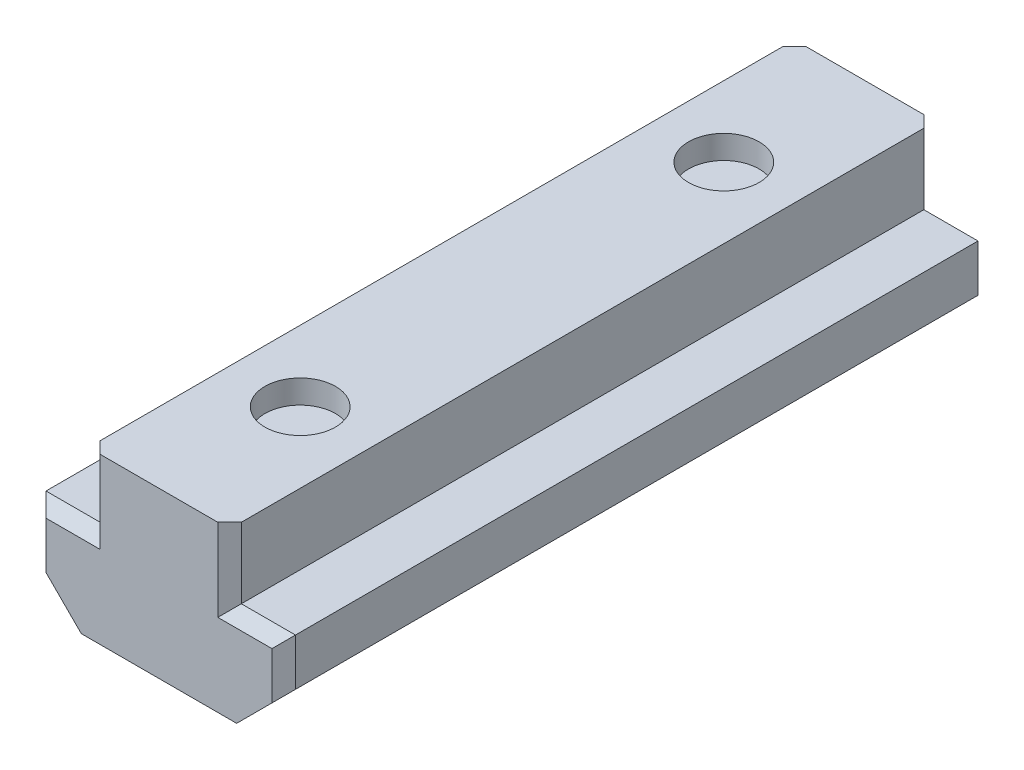
from build123d import *

# Parameters (mm, degrees)
EXTRUDE_1_DEPTH     = 15
CHAMFER_1_SIZE      = 2
CHAMFER_2_SIZE      = 0.5
MIRROR_START        = -9.237604307
MIRROR_2_DEPTH      = 2.598076211
MIRROR_START_2      = 6.639528096
MIRROR_2_2_DEPTH    = 2.598076211
SKETCH_2_R          = 1.5
CUT_EXTRUDE_1_DEPTH = 1


# Read off the part's stored shape, not the designer's step: 镜向2
with BuildPart() as part:
    # 草图1 → 凸台-拉伸1 (new, symmetric)
    with BuildSketch(Plane.XY):
        Polygon((-3, 0), (3, 0), (3, -3), (5.3, -3), (5.3, -7), (-5.3, -7), (-5.3, -3), (-3, -3), align=None)
    extrude(amount=EXTRUDE_1_DEPTH, both=True)

    # 倒角1
    chamfer_1_edges = [part.edges().sort_by_distance(p)[0] for p in [
        (5.3, -7, 0),
        (-5.3, -7, 0),
    ]]
    chamfer(chamfer_1_edges, length=CHAMFER_1_SIZE)

    # 倒角2
    chamfer_2_edges = [part.edges().sort_by_distance(p)[0] for p in [
        (-3, -1.5, 15),
        (-4.15, -3, 15),
        (-5.3, -4, 15),
        (5.3, -4, 15),
        (4.15, -3, 15),
        (3, -1.5, 15),
    ]]
    chamfer(chamfer_2_edges, length=CHAMFER_2_SIZE)

    # 镜向2 outline → 镜向2 (cut)
    with BuildSketch(Plane(origin=(0, 0, 0), x_dir=(0.816496580927727, -0.4082482904638606, -0.4082482904638635), z_dir=(0.5773502691896244, 0.5773502691896244, 0.5773502691896285)).offset(MIRROR_START)):
        Polygon((9.593834826, 8.131727984), (11.471776962, 8.131727984), (12.288273543, 6.717514421), (13.279880956, 5), (14, 5), (14, 12), (7.360486936, 12), (8.164965809, 10.606601718), align=None)
    extrude(amount=MIRROR_2_DEPTH, mode=Mode.SUBTRACT)

    # Mirror 2 2 outline → Mirror 2 2 (cut)
    with BuildSketch(Plane(origin=(0, 0, 0), x_dir=(0.816496580927727, 0.4082482904638606, 0.4082482904638635), z_dir=(0.5773502691896244, -0.5773502691896244, -0.5773502691896285)).offset(MIRROR_START_2)):
        Polygon((-8.164965809, -10.606601718), (-9.593834826, -8.131727984), (-11.471776962, -8.131727984), (-12.288273543, -6.717514421), (-13.279880956, -5), (-14, -5), (-14, -12), (-7.360486936, -12), align=None)
    extrude(amount=MIRROR_2_2_DEPTH, mode=Mode.SUBTRACT)

    # 草图2 → 切除-拉伸1 (cut)
    with BuildSketch(Plane(origin=(0, 0, 0), x_dir=(1, 0, 0), z_dir=(0, 1, 0))):
        with Locations(Location((0, 9, 0), (0, 0, 270))):
            Circle(SKETCH_2_R)
        with Locations(Location((0, -9, 0), (0, 0, 90))):
            Circle(SKETCH_2_R)
    extrude(amount=-CUT_EXTRUDE_1_DEPTH, mode=Mode.SUBTRACT)


solid = part.part
